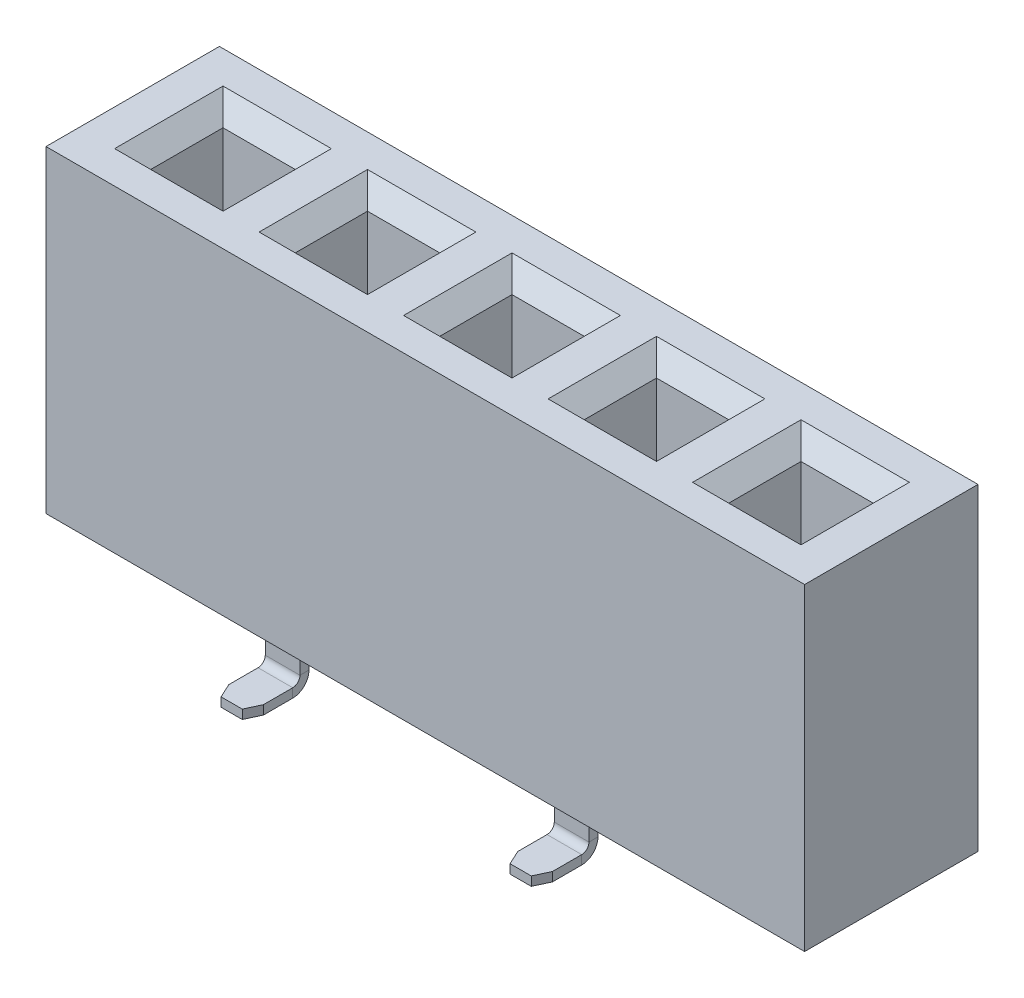
from build123d import *
from OCP.BRepFilletAPI import BRepFilletAPI_MakeChamfer

# Parameters (mm, degrees)
SKETCH1_W                  = 10.5
SKETCH1_H                  = 4.4
BOSS_EXTRUDE1_DEPTH        = 2.4
SKETCH2_W                  = 1
SKETCH2_H                  = 1
CUT_EXTRUDE1_DEPTH         = 2.5
CHAMFER1_SIZE              = 0.25
LPATTERN6_COUNT            = 5
LPATTERN6_PITCH            = 2
CHAMFER1_OF_LPATTERN6_SIZE = 0.25
BASE_FLANGE2_DEPTH         = 0.24
BASE_FLANGE2_DEPTH_BACK    = 0.24
BASE_FLANGE3_DEPTH         = 0.24
BASE_FLANGE3_DEPTH_BACK    = 0.24
CHAMFER3_SIZE              = 0.2
CHAMFER3_SIZE2             = 0.093261532
CHAMFER4_SIZE              = 0.2
CHAMFER4_SIZE2             = 0.093261532
LPATTERN4_COUNT            = 3
LPATTERN4_PITCH            = 4
LPATTERN3_COUNT            = 2
LPATTERN3_PITCH            = 4


# Sheet-metal steps are written as plain solids
with BuildPart() as part:
    # Sketch1 → Boss-Extrude1 (new body)
    with BuildSketch(Plane.XY):
        Rectangle(SKETCH1_W, SKETCH1_H)
    extrude(amount=BOSS_EXTRUDE1_DEPTH)

    # Sketch2 → Cut-Extrude1 (cut)
    with BuildSketch(Plane(origin=(0, 2.2, 0), x_dir=(1, 0, 0), z_dir=(0, 1, 0))):
        with Locations((-4, -1.2)):
            Rectangle(SKETCH2_W, SKETCH2_H)
    cut_extrude1 = extrude(amount=-CUT_EXTRUDE1_DEPTH, mode=Mode.SUBTRACT)

    # Chamfer1
    chamfer1_edges = [part.edges().sort_by_distance(p)[0] for p in [
        (-3.5, 2.2, 1.2),
        (-4, 2.2, 0.7),
        (-4.5, 2.2, 1.2),
        (-4, 2.2, 1.7),
    ]]
    chamfer(chamfer1_edges, length=CHAMFER1_SIZE)

    # LPattern6: Cut-Extrude1 ×5
    with Locations(*[(i * LPATTERN6_PITCH, 0, 0) for i in range(1, LPATTERN6_COUNT)]):
        add(cut_extrude1, mode=Mode.SUBTRACT)

    # Chamfer1 of LPattern6
    chamfer1_of_lpattern6_edges = [part.edges().sort_by_distance(p)[0] for p in [
        (-1.5, 2.2, 1.2),
        (-2, 2.2, 0.7),
        (-2.5, 2.2, 1.2),
        (-2, 2.2, 1.7),
        (0.5, 2.2, 1.2),
        (0, 2.2, 0.7),
        (-0.5, 2.2, 1.2),
        (0, 2.2, 1.7),
        (2.5, 2.2, 1.2),
        (2, 2.2, 0.7),
        (1.5, 2.2, 1.2),
        (2, 2.2, 1.7),
        (4.5, 2.2, 1.2),
        (4, 2.2, 0.7),
        (3.5, 2.2, 1.2),
        (4, 2.2, 1.7),
    ]]
    chamfer(chamfer1_of_lpattern6_edges, length=CHAMFER1_OF_LPATTERN6_SIZE)


with BuildPart() as body_2:
    # Sketch5 → Base-Flange2 (new, two sides: drawn at the far end of the back side and taken through both)
    with BuildSketch(Plane.ZY.offset(4).offset(-BASE_FLANGE2_DEPTH_BACK)):
        with BuildLine():
            Line((0.15, -2.2), (0.15, -2.405))
            ThreePointArc((0.15, -2.405), (0.084099026, -2.564099026), (-0.075, -2.63))
            Line((-0.075, -2.63), (-0.68, -2.63))
            Line((-0.68, -2.63), (-0.68, -2.505))
            Line((-0.68, -2.505), (-0.075, -2.505))
            ThreePointArc((-0.075, -2.505), (-0.004289322, -2.475710678), (0.025, -2.405))
            Line((0.025, -2.405), (0.025, -2.2))
            Line((0.025, -2.2), (0.15, -2.2))
        make_face()
    extrude(amount=BASE_FLANGE2_DEPTH + BASE_FLANGE2_DEPTH_BACK)

    # Chamfer4: one chamfer whose edges measure the first distance from different faces: ONE call of the kernel's chamfer builder (chamfer() names one face for all edges)
    chamfer4_edges_1 = [body_2.edges().sort_by_distance(p)[0] for p in [
        (-3.76, -2.5675, -0.68),
    ]]
    chamfer4_side_1 = [body_2.faces().sort_by_distance(p)[0] for p in [
        (-3.76, -2.3025, 0.034347727),
    ]]
    chamfer4_edges_2 = [body_2.edges().sort_by_distance(p)[0] for p in [
        (-4.24, -2.5675, -0.68),
    ]]
    chamfer4_side_2 = [body_2.faces().sort_by_distance(p)[0] for p in [
        (-4.24, -2.3025, 0.034347727),
    ]]
    chamfer4 = BRepFilletAPI_MakeChamfer(body_2.part.solid().wrapped)
    for e in chamfer4_edges_1:
        chamfer4.Add(CHAMFER4_SIZE, CHAMFER4_SIZE2, e.wrapped, chamfer4_side_1[0].wrapped)  # the first distance lies on this face
    for e in chamfer4_edges_2:
        chamfer4.Add(CHAMFER4_SIZE, CHAMFER4_SIZE2, e.wrapped, chamfer4_side_2[0].wrapped)  # the first distance lies on this face
    add(Compound.cast(chamfer4.Shape()), mode=Mode.REPLACE)


with BuildPart() as body_3:
    # Sketch22 → Base-Flange3 (new, two sides: drawn at the far end of the back side and taken through both)
    with BuildSketch(Plane.ZY.offset(2).offset(-BASE_FLANGE3_DEPTH_BACK)):
        with BuildLine():
            Line((2.25, -2.2), (2.25, -2.405))
            ThreePointArc((2.25, -2.405), (2.315900974, -2.564099026), (2.475, -2.63))
            Line((2.475, -2.63), (3.08, -2.63))
            Line((3.08, -2.63), (3.08, -2.505))
            Line((3.08, -2.505), (2.475, -2.505))
            ThreePointArc((2.475, -2.505), (2.404289322, -2.475710678), (2.375, -2.405))
            Line((2.375, -2.405), (2.375, -2.2))
            Line((2.375, -2.2), (2.25, -2.2))
        make_face()
    extrude(amount=BASE_FLANGE3_DEPTH + BASE_FLANGE3_DEPTH_BACK)

    # Chamfer3: one chamfer whose edges measure the first distance from different faces: ONE call of the kernel's chamfer builder (chamfer() names one face for all edges)
    chamfer3_edges_1 = [body_3.edges().sort_by_distance(p)[0] for p in [
        (-1.76, -2.5675, 3.08),
    ]]
    chamfer3_side_1 = [body_3.faces().sort_by_distance(p)[0] for p in [
        (-1.76, -2.3025, 2.365652273),
    ]]
    chamfer3_edges_2 = [body_3.edges().sort_by_distance(p)[0] for p in [
        (-2.24, -2.5675, 3.08),
    ]]
    chamfer3_side_2 = [body_3.faces().sort_by_distance(p)[0] for p in [
        (-2.24, -2.3025, 2.365652273),
    ]]
    chamfer3 = BRepFilletAPI_MakeChamfer(body_3.part.solid().wrapped)
    for e in chamfer3_edges_1:
        chamfer3.Add(CHAMFER3_SIZE, CHAMFER3_SIZE2, e.wrapped, chamfer3_side_1[0].wrapped)  # the first distance lies on this face
    for e in chamfer3_edges_2:
        chamfer3.Add(CHAMFER3_SIZE, CHAMFER3_SIZE2, e.wrapped, chamfer3_side_2[0].wrapped)  # the first distance lies on this face
    add(Compound.cast(chamfer3.Shape()), mode=Mode.REPLACE)


with BuildPart() as lpattern4_1:
    # LPattern4: pattern copy
    add(body_2.part.moved(Location(Vector(1, 0, 0) * (1 * LPATTERN4_PITCH))))


with BuildPart() as lpattern4_2:
    # LPattern4: pattern copy
    add(body_2.part.moved(Location(Vector(1, 0, 0) * (2 * LPATTERN4_PITCH))))


with BuildPart() as lpattern3_1:
    # LPattern3: pattern copy
    add(body_3.part.moved(Location(Vector(1, 0, 0) * (1 * LPATTERN3_PITCH))))


solid = Compound([part.part, body_2.part, body_3.part, lpattern4_1.part, lpattern4_2.part, lpattern3_1.part])
